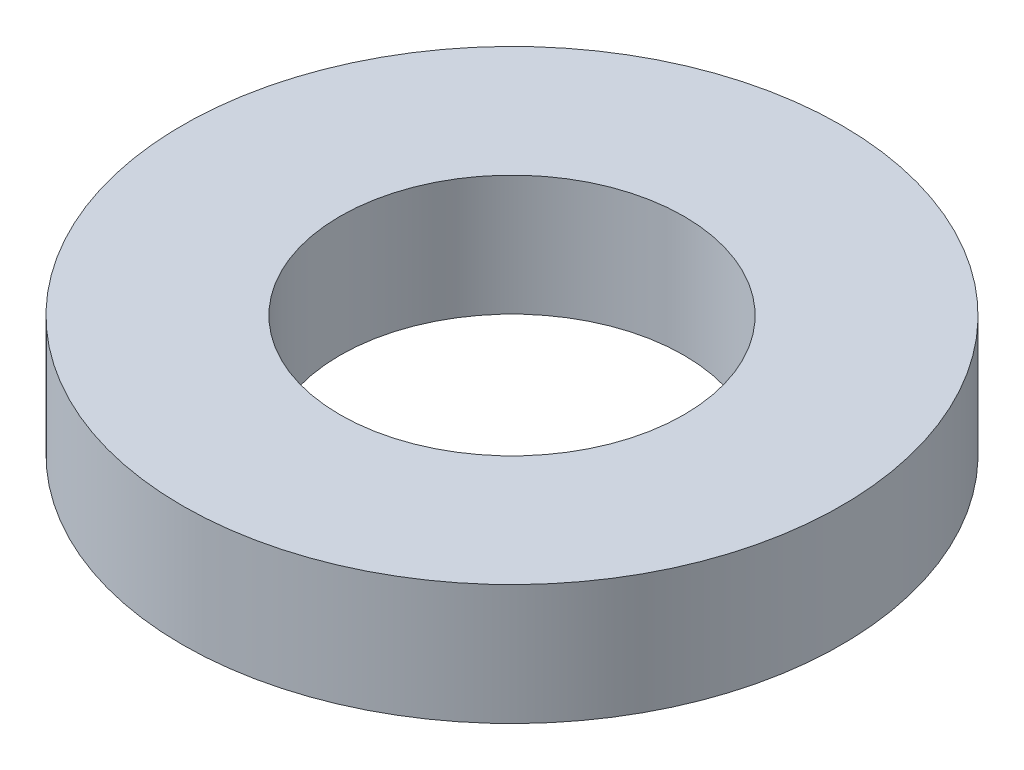
from build123d import *

# Parameters (mm, degrees)
SKETCH1_R           = 57.5
BOSS_EXTRUDE1_DEPTH = 21
SKETCH2_R           = 30
CUT_EXTRUDE1_DEPTH  = 84.985117729


with BuildPart() as part:
    # Sketch1 → Boss-Extrude1 (new body)
    with BuildSketch(Plane(origin=(0, 0, 0), x_dir=(1, 0, 0), z_dir=(0, 1, 0))):
        Circle(SKETCH1_R)
    extrude(amount=BOSS_EXTRUDE1_DEPTH)

    # Sketch2 → Cut-Extrude1 (cut, through all)
    with BuildSketch(Plane(origin=(0, 0, 0), x_dir=(1, 0, 0), z_dir=(0, 1, 0))):
        Circle(SKETCH2_R)
    extrude(amount=CUT_EXTRUDE1_DEPTH, mode=Mode.SUBTRACT)


solid = part.part
